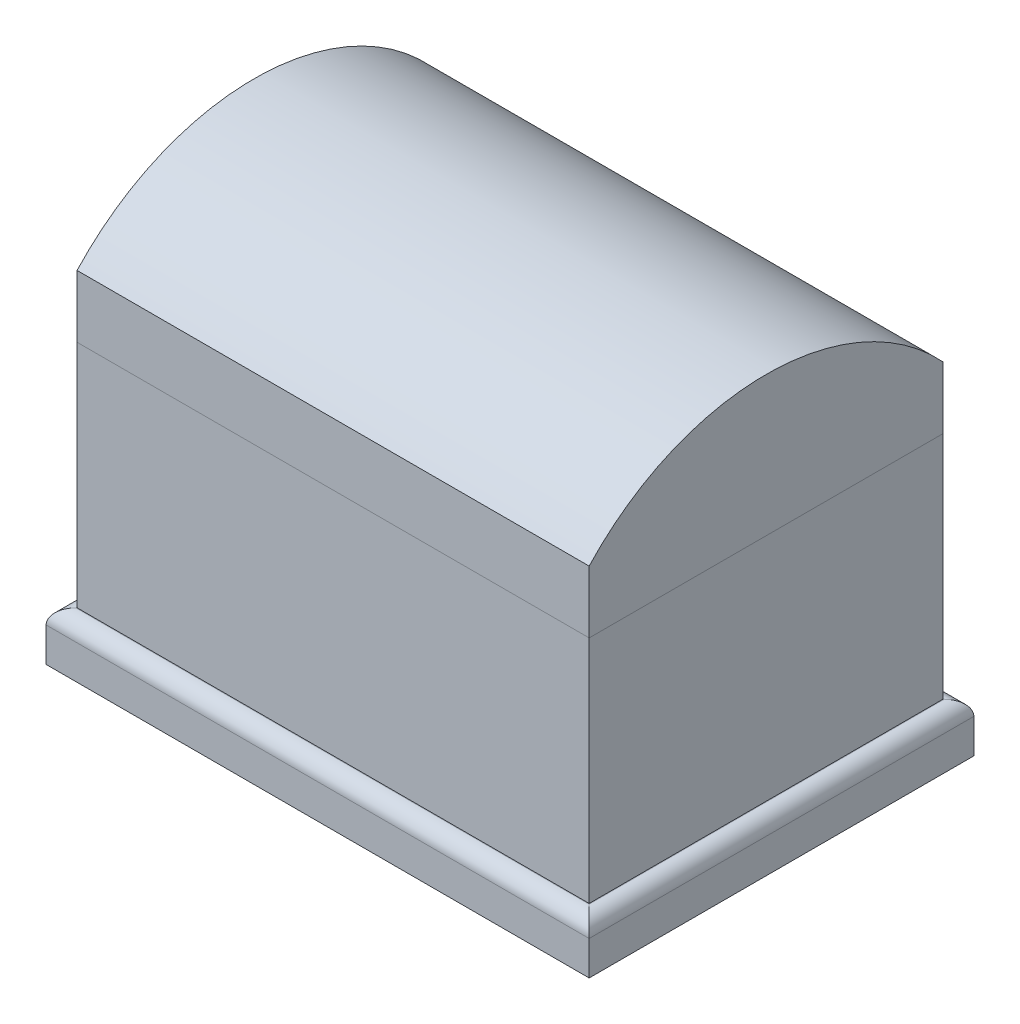
from build123d import *

# Parameters (mm, degrees)
SKETCH1_W           = 157.734
SKETCH1_H           = 108.966
BOSS_EXTRUDE1_DEPTH = 114.1349
CUT_EXTRUDE1_DEPTH  = 208.224316094
SHELL1_T            = -7.0104
SHELL2_T            = -7.0104


with BuildPart() as part:
    # Sketch1 → Boss-Extrude1 (new body)
    with BuildSketch(Plane(origin=(0, 0, 0), x_dir=(1, 0, 0), z_dir=(0, 1, 0))):
        Rectangle(SKETCH1_W, SKETCH1_H)
    extrude(amount=BOSS_EXTRUDE1_DEPTH)

    # Sweep1: sweep along a path in Sketch3
    with BuildLine(Plane.XZ) as sweep1_path:
        Line((78.867, -54.483), (78.867, 54.483))
        Line((78.867, 54.483), (-78.867, 54.483))
        Line((-78.867, 54.483), (-78.867, -54.483))
        Line((-78.867, -54.483), (78.867, -54.483))
    # Sketch2 → Sweep1 (sweep)
    with BuildSketch(Plane.XY.offset(54.483)):
        with BuildLine():
            Line((-78.867, 0), (-79.0575, 0))
            ThreePointArc((-79.0575, 0), (-82.290392204, -1.339107796), (-83.6295, -4.572))
            Line((-83.6295, -4.572), (-83.6295, -15.113))
            Line((-83.6295, -15.113), (-73.7235, -15.113))
            Line((-73.7235, -15.113), (-73.7235, 0))
            Line((-73.7235, 0), (-78.867, 0))
        make_face()
    sweep(path=sweep1_path.line, transition=Transition.RIGHT)

    # Sketch4 → Cut-Extrude1 (cut, through all)
    with BuildSketch(Plane.ZY.offset(78.867)):
        with BuildLine():
            Line((-54.483, 90.0049), (-54.483, 114.1349))
            Line((-54.483, 114.1349), (54.483, 114.1349))
            Line((54.483, 114.1349), (54.483, 90.0049))
            ThreePointArc((54.483, 90.0049), (0, 113.8809), (-54.483, 90.0049))
        make_face()
    extrude(amount=-CUT_EXTRUDE1_DEPTH, mode=Mode.SUBTRACT)


with BuildPart() as body_2:
    # Split1: the piece on the far side of the plane
    add(part.part)
    split(bisect_by=Plane.ZX.offset(70.8406), keep=Keep.BOTTOM)

    # Shell1
    shell1_openings = [body_2.faces().sort_by_distance(p)[0] for p in [
        (0, 70.8406, 0),
    ]]
    offset(amount=SHELL1_T, openings=shell1_openings, kind=Kind.INTERSECTION)


with BuildPart() as part_1:
    add(part.part)

    # Split1
    split(bisect_by=Plane.ZX.offset(70.8406), keep=Keep.TOP)

    # Shell2
    shell2_openings = [part_1.faces().sort_by_distance(p)[0] for p in [
        (0, 70.8406, 0),
    ]]
    offset(amount=SHELL2_T, openings=shell2_openings, kind=Kind.INTERSECTION)


solid = Compound([body_2.part, part_1.part])
